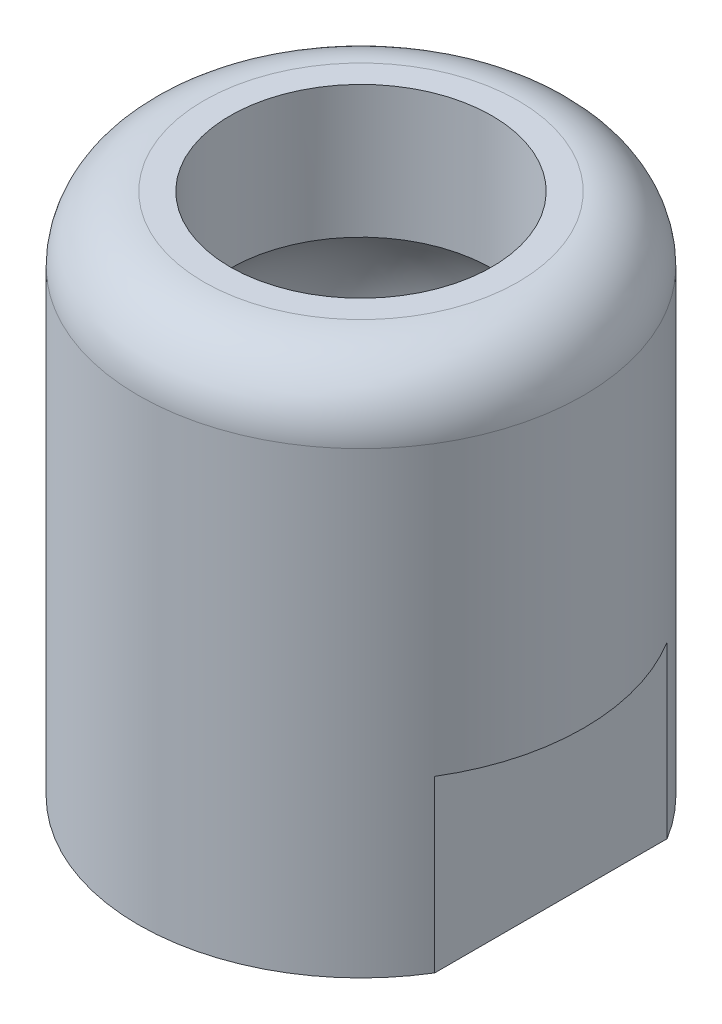
from build123d import *
from build123d.topology import SkipClean

# Parameters (mm, degrees)
SKETCH1_R               = 11
BOSS_EXTRUDE1_DEPTH     = 280
SKETCH2_R               = 17
BOSS_EXTRUDE2_DEPTH     = 40
BOSS_EXTRUDE3_START     = 40
SKETCH3_R               = 17
BOSS_EXTRUDE3_DEPTH     = 40
FILLET1_R               = 5
FILLET2_R               = 5
CUT_EXTRUDE1_DEPTH      = 40
CUT_EXTRUDE1_DEPTH_BACK = 40
SKETCH4_W               = 2.5
SKETCH4_H               = 13
SKETCH5_R               = 10
CUT_EXTRUDE2_DEPTH      = 35
CUT_EXTRUDE3_START      = -35
SKETCH6_R               = 10
CUT_EXTRUDE3_DEPTH      = 35
SKETCH8_W               = 103.728134289
SKETCH8_H               = 321.250048498
CUT_EXTRUDE4_DEPTH      = 25
SKETCH9_R               = 6.5
CUT_EXTRUDE5_DEPTH      = 20
THREAD1_PITCH           = 1.5


with BuildPart() as part:
    # Sketch1 → Boss-Extrude1 (new body)
    with BuildSketch(Plane(origin=(0, 0, 0), x_dir=(1, 0, 0), z_dir=(0, 1, 0))):
        with Locations(Location((0, 0, 0), (0, 0, 270))):
            Circle(SKETCH1_R)
    extrude(amount=BOSS_EXTRUDE1_DEPTH)

    # Sketch2 → Boss-Extrude2 (add)
    with BuildSketch(Plane(origin=(0, 280, 0), x_dir=(1, 0, 0), z_dir=(0, 1, 0))):
        with Locations(Location((0, 0, 0), (0, 0, 270))):
            Circle(SKETCH2_R)
    extrude(amount=BOSS_EXTRUDE2_DEPTH)

    # Sketch3 → Boss-Extrude3 (add)
    with BuildSketch(Plane.XZ.offset(BOSS_EXTRUDE3_START)):
        with Locations(Location((0, 0, 0), (0, 0, 90))):
            Circle(SKETCH3_R)
    extrude(amount=-BOSS_EXTRUDE3_DEPTH)

    # Fillet1
    fillet1_edges = [part.edges().sort_by_distance(p)[0] for p in [
        (0, -40, -17),
    ]]
    fillet(fillet1_edges, radius=FILLET1_R)

    # Fillet2
    fillet2_edges = [part.edges().sort_by_distance(p)[0] for p in [
        (0, 320, -17),
    ]]
    fillet(fillet2_edges, radius=FILLET2_R)

    # Sketch4 → Cut-Extrude1 (cut, two sides: drawn at the far end of the back side and taken through both)
    with BuildSketch(Plane.XY.offset(-CUT_EXTRUDE1_DEPTH_BACK)):
        with Locations((15.75, 286.5)):
            Rectangle(SKETCH4_W, SKETCH4_H)
        with Locations((-15.75, 286.5)):
            Rectangle(SKETCH4_W, SKETCH4_H)
        with Locations((15.75, -6.5)):
            Rectangle(SKETCH4_W, SKETCH4_H)
        with Locations((-15.75, -6.5)):
            Rectangle(SKETCH4_W, SKETCH4_H)
    extrude(amount=CUT_EXTRUDE1_DEPTH + CUT_EXTRUDE1_DEPTH_BACK, mode=Mode.SUBTRACT)

    # Sketch5 → Cut-Extrude2 (cut)
    with BuildSketch(Plane.XZ.offset(40)):
        with Locations(Location((0, 0, 0), (0, 0, 270))):
            Circle(SKETCH5_R)
    extrude(amount=-CUT_EXTRUDE2_DEPTH, mode=Mode.SUBTRACT)

    # Sketch6 → Cut-Extrude3 (cut)
    with BuildSketch(Plane(origin=(0, 320, 0), x_dir=(1, 0, 0), z_dir=(0, 1, 0)).offset(CUT_EXTRUDE3_START)):
        with Locations(Location((0, 0, 0), (0, 0, 90))):
            Circle(SKETCH6_R)
    extrude(amount=CUT_EXTRUDE3_DEPTH, mode=Mode.SUBTRACT)

    # Sketch7 → Cut-Revolve4 (revolve, cut)
    with BuildSketch(Plane.XY):
        with BuildLine():
            Line((0, 314.897444364), (0, 289.897444364))
            ThreePointArc((0, 289.897444364), (12.5, 302.397444364), (0, 314.897444364))
        make_face()
        with BuildLine():
            Line((0, -9.795474592), (0, -34.795474592))
            ThreePointArc((0, -34.795474592), (12.5, -22.295474592), (0, -9.795474592))
        make_face()
    revolve(axis=Axis((0, 285, 0), (0, 1, 0)), mode=Mode.SUBTRACT)

    # Sketch8 → Cut-Extrude4 (cut, symmetric)
    with BuildSketch(Plane.XY):
        with Locations((-0.028069299, 119.374975751)):
            Rectangle(SKETCH8_W, SKETCH8_H)
    extrude(amount=CUT_EXTRUDE4_DEPTH, both=True, mode=Mode.SUBTRACT)

    # Sketch9 → Cut-Extrude5 (cut)
    with BuildSketch(Plane.XZ.offset(-280)):
        with Locations(Location((0, 0, 0), (0, 0, 270))):
            Circle(SKETCH9_R)
    extrude(amount=-CUT_EXTRUDE5_DEPTH, mode=Mode.SUBTRACT)

    # Thread1: the profile of Thread Profile1 profile screwed along a right-hand helix of 17.333333 turns, 8 arcs to a turn; built about Z, then put on its axis
    with SkipClean():  # the faces are left unmerged after this step: merging them gives an invalid solid
        thread1_z = Axis((0, 0, 0), (0, 0, 1))
        thread1_corners = [(6.4997, 0, -0.000173205), (7.311898813, 0, 0.468749998), (7.311898813, 0, 0.656249998), (6.4997, 0, 1.125173201)]
        with BuildLine(mode=Mode.PRIVATE) as thread1_profile:
            Line(thread1_corners[0], thread1_corners[1])
            Line(thread1_corners[1], thread1_corners[2])
            Line(thread1_corners[2], thread1_corners[3])
            Line(thread1_corners[3], thread1_corners[0])
        thread1_cap = Face(thread1_profile.wire())
        thread1_turn_angles = [0, 22.5, 45, 67.5, 90, 112.5, 135, 157.5, 180, 202.5, 225, 247.5, 270, 292.5, 315, 337.5, 360]
        thread1_turn_weights = [1, 0.9238795325112867, 1, 0.9238795325112867, 1, 0.9238795325112867, 1, 0.9238795325112867, 1, 0.9238795325112867, 1, 0.9238795325112867, 1, 0.9238795325112867, 1, 0.9238795325112867, 1]
        thread1_turn_rails = [Edge.make_bspline([Vector(p[0], p[1], 0).rotate(thread1_z, thread1_turn_angles[k]) / thread1_turn_weights[k] + Vector(0, 0, p[2] + THREAD1_PITCH * thread1_turn_angles[k] / 360) for k in range(17)], [0, 0, 0, 1, 1, 2, 2, 3, 3, 4, 4, 5, 5, 6, 6, 7, 7, 8, 8, 8], 2, thread1_turn_weights) for p in thread1_corners]
        thread1_turn_sides = [Face.make_surface_from_curves(thread1_turn_rails[p[0]], thread1_turn_rails[p[1]]) for p in [(0, 1), (1, 2), (2, 3), (3, 0)]]
        thread1_last_angles = [6120, 6142.5, 6165, 6187.5, 6210, 6225, 6240]
        thread1_last_weights = [1, 0.9238795325112867, 1, 0.9238795325112867, 1, 0.9659258262890683, 1]
        thread1_last_rails = [Edge.make_bspline([Vector(p[0], p[1], 0).rotate(thread1_z, thread1_last_angles[k]) / thread1_last_weights[k] + Vector(0, 0, p[2] + THREAD1_PITCH * thread1_last_angles[k] / 360) for k in range(7)], [0, 0, 0, 1, 1, 2, 2, 3, 3, 3], 2, thread1_last_weights) for p in thread1_corners]
        thread1_last_sides = [Face.make_surface_from_curves(thread1_last_rails[p[0]], thread1_last_rails[p[1]]) for p in [(0, 1), (1, 2), (2, 3), (3, 0)]]
        thread1 = Plane(origin=(0, 280, 0), x_dir=(1, 0, 0), z_dir=(0, 1, 0)) * Solid(Shell([*[p.moved(Location((0, 0, THREAD1_PITCH * i))) for i in range(17) for p in thread1_turn_sides], *thread1_last_sides, thread1_cap, thread1_cap.rotate(thread1_z, 6240).moved(Location((0, 0, THREAD1_PITCH * 6240 / 360)))]))
        add(thread1, mode=Mode.SUBTRACT)


solid = part.part
